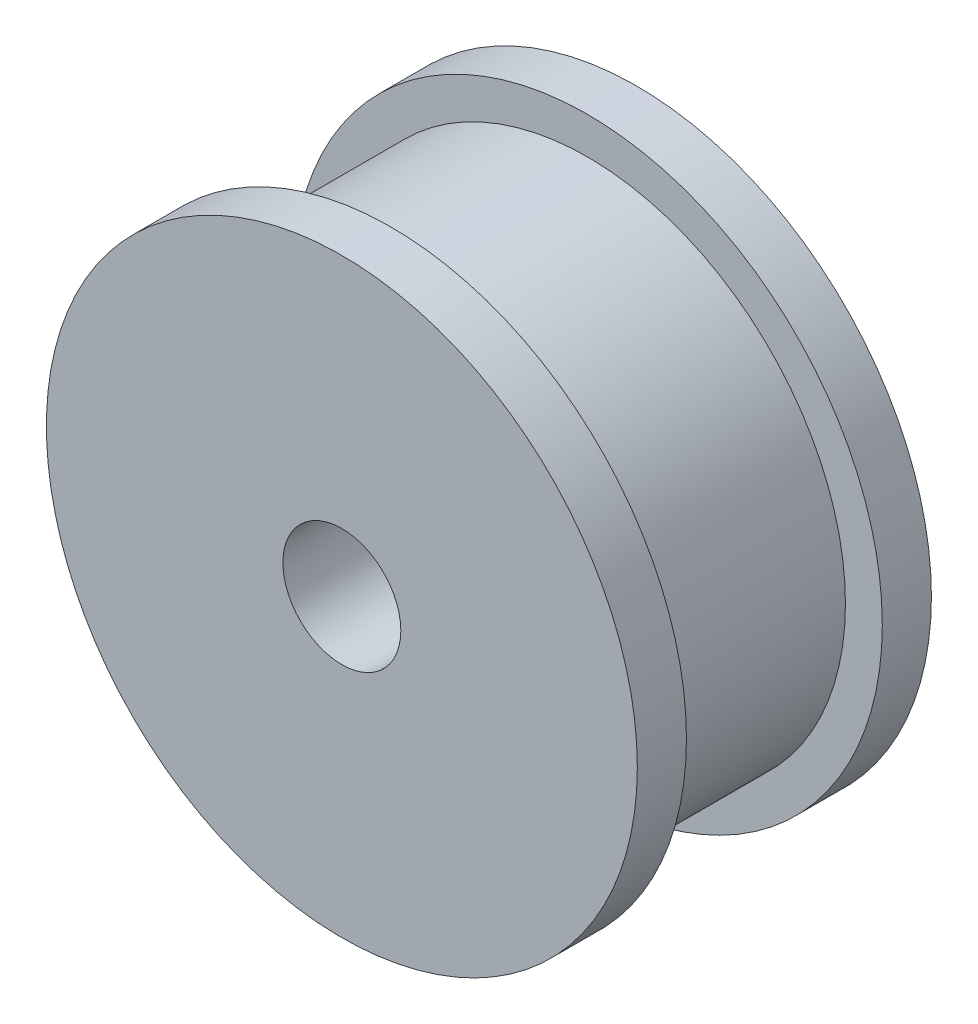
from build123d import *

# Parameters (mm, degrees)
ESBO_O1_R                = 10.5
ESBO_O1_R_2              = 2.4
RESSALTO_EXTRUS_O1_DEPTH = 8
RESSALTO_EXTRUS_O2_START = -2
ESBO_O2_R                = 12
ESBO_O2_R_2              = 2.4
RESSALTO_EXTRUS_O2_DEPTH = 2
F_3DSKETCH2_R            = 12.027868724
F_3DSKETCH2_R_2          = 2.4
RESSALTO_EXTRUS_O3_DEPTH = 2


with BuildPart() as part:
    # Esboço1 → Ressalto-extrusão1 (new body)
    with BuildSketch(Plane.XY):
        Circle(ESBO_O1_R)
        Circle(ESBO_O1_R_2, mode=Mode.SUBTRACT)
    extrude(amount=RESSALTO_EXTRUS_O1_DEPTH)

    # Esboço2 → Ressalto-extrusão2 (add)
    with BuildSketch(Plane.XY.offset(RESSALTO_EXTRUS_O2_START)):
        Circle(ESBO_O2_R)
        Circle(ESBO_O2_R_2, mode=Mode.SUBTRACT)
    extrude(amount=RESSALTO_EXTRUS_O2_DEPTH)

    # 3DSketch2 → Ressalto-extrusão3 (add)
    with BuildSketch(Plane.XY.offset(8)):
        Circle(F_3DSKETCH2_R)
        Circle(F_3DSKETCH2_R_2, mode=Mode.SUBTRACT)
    extrude(amount=RESSALTO_EXTRUS_O3_DEPTH)


solid = part.part
